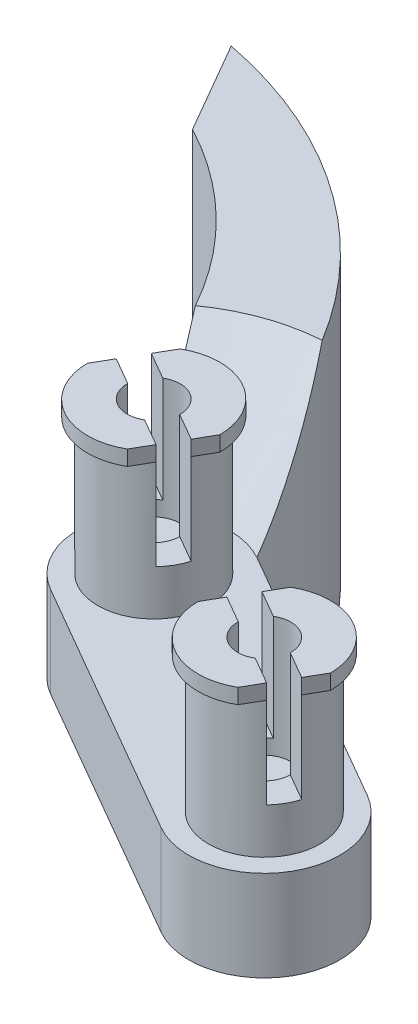
from build123d import *

# Parameters (mm, degrees)
BOSS_EXTRUDE4_DEPTH       = 6
SKETCH1_10_R              = 3.7
SKETCH1_10_R_2            = 1.75
BOSS_EXTRUDE6_DEPTH       = 15
CUT_EXTRUDE1_START        = -6
CUT_EXTRUDE1_DEPTH        = 6
SKETCH6_R                 = 1.75
BOSS_EXTRUDE7_DEPTH       = 2
BOSS_EXTRUDE8_DEPTH       = 1
BOSS_EXTRUDE10_DEPTH      = 13
BOSS_EXTRUDE10_DEPTH_BACK = 6
CHAMFER2_SIZE             = 7
CUT_EXTRUDE2_DEPTH        = 1


with BuildPart() as part:
    # Sketch1 → Boss-Extrude4 (new body)
    with BuildSketch(Plane(origin=(0, 0, 0), x_dir=(1, 0, 0), z_dir=(0, 1, 0))):
        with BuildLine():
            Line((2.5, 4.330127019), (-14.820508076, 14.330127019))
            ThreePointArc((-14.820508076, 14.330127019), (-18.6051305, 14.794276156), (-21.650635095, 12.5))
            ThreePointArc((-21.650635095, 12.5), (-22.150137207, 8.705904774), (-19.820508076, 5.669872981))
            Line((-19.820508076, 5.669872981), (-2.5, -4.330127019))
            ThreePointArc((-2.5, -4.330127019), (4.330127019, -2.5), (2.5, 4.330127019))
        make_face()
    extrude(amount=BOSS_EXTRUDE4_DEPTH)

    # Sketch1<10> → Boss-Extrude6 (add)
    # profile 1 of 2: a face of its own
    with BuildSketch(Plane(origin=(0, 0, 0), x_dir=(1, 0, 0), z_dir=(0, 1, 0))):
        with Locations(Location((0, 0, 0), (0, 0, 270))):
            Circle(SKETCH1_10_R)
        with Locations(Location((0, 0, 0), (0, 0, 270))):
            Circle(SKETCH1_10_R_2, mode=Mode.SUBTRACT)
    # profile 2 of 2: a face of its own
    with BuildSketch(Plane(origin=(0, 0, 0), x_dir=(1, 0, 0), z_dir=(0, 1, 0))):
        with Locations(Location((-17.320508076, 10, 0), (0, 0, 270))):
            Circle(SKETCH1_10_R)
        with Locations(Location((-17.320508076, 10, 0), (0, 0, 270))):
            Circle(SKETCH1_10_R_2, mode=Mode.SUBTRACT)
    extrude(amount=BOSS_EXTRUDE6_DEPTH)

    # Sketch5 → Cut-Extrude1 (cut)
    with BuildSketch(Plane(origin=(0, 15, 0), x_dir=(1, 0, 0), z_dir=(0, 1, 0)).offset(CUT_EXTRUDE1_START)):
        with BuildLine():
            Line((-20.014101509, 12.536642351), (-18.220272206, 11.50097452))
            ThreePointArc((-18.220272206, 11.50097452), (-18.836052532, 10.875), (-19.070272206, 10.028731334))
            Line((-19.070272206, 10.028731334), (-20.864101509, 11.064399165))
            ThreePointArc((-20.864101509, 11.064399165), (-20.52480207, 11.85), (-20.014101509, 12.536642351))
        make_face()
        with BuildLine():
            Line((-13.776914643, 8.935600835), (-15.570743946, 9.971268666))
            ThreePointArc((-15.570743946, 9.971268666), (-15.804963619, 9.125), (-16.420743946, 8.49902548))
            Line((-16.420743946, 8.49902548), (-14.626914643, 7.463357649))
            ThreePointArc((-14.626914643, 7.463357649), (-14.116214082, 8.15), (-13.776914643, 8.935600835))
        make_face()
        with BuildLine():
            Line((2.693593433, -2.536642351), (0.89976413, -1.50097452))
            ThreePointArc((0.89976413, -1.50097452), (1.515544457, -0.875), (1.74976413, -0.028731334))
            Line((1.74976413, -0.028731334), (3.543593433, -1.064399165))
            ThreePointArc((3.543593433, -1.064399165), (3.204293994, -1.85), (2.693593433, -2.536642351))
        make_face()
        with BuildLine():
            Line((-3.543593433, 1.064399165), (-1.74976413, 0.028731334))
            ThreePointArc((-1.74976413, 0.028731334), (-1.515544457, 0.875), (-0.89976413, 1.50097452))
            Line((-0.89976413, 1.50097452), (-2.693593433, 2.536642351))
            ThreePointArc((-2.693593433, 2.536642351), (-3.204293994, 1.85), (-3.543593433, 1.064399165))
        make_face()
    extrude(amount=CUT_EXTRUDE1_DEPTH, mode=Mode.SUBTRACT)

    # Sketch6 → Boss-Extrude7 (add)
    with BuildSketch(Plane(origin=(0, 6, 0), x_dir=(1, 0, 0), z_dir=(0, 1, 0))):
        with Locations(Location((-17.320508076, 10, 0), (0, 0, 120.940718932))):
            Circle(SKETCH6_R)
        with Locations(Location((0, 0, 0), (0, 0, 90))):
            Circle(SKETCH6_R)
    extrude(amount=BOSS_EXTRUDE7_DEPTH)

    # Sketch8 → Boss-Extrude8 (add)
    with BuildSketch(Plane(origin=(0, 15, 0), x_dir=(1, 0, 0), z_dir=(0, 1, 0))):
        with BuildLine():
            Line((-18.220272206, 11.50097452), (-20.447114211, 12.786642351))
            ThreePointArc((-20.447114211, 12.786642351), (-15.161166743, 13.7400889), (-13.343901941, 8.685600835))
            Line((-13.343901941, 8.685600835), (-15.570743946, 9.971268666))
            ThreePointArc((-15.570743946, 9.971268666), (-16.445508076, 11.515544457), (-18.220272206, 11.50097452))
        make_face()
        with BuildLine():
            Line((-16.420743946, 8.49902548), (-14.193901941, 7.213357649))
            ThreePointArc((-14.193901941, 7.213357649), (-19.479849409, 6.2599111), (-21.297114211, 11.314399165))
            Line((-21.297114211, 11.314399165), (-19.070272206, 10.028731334))
            ThreePointArc((-19.070272206, 10.028731334), (-18.195508076, 8.484455543), (-16.420743946, 8.49902548))
        make_face()
        with BuildLine():
            Line((0.89976413, -1.50097452), (3.126606135, -2.786642351))
            ThreePointArc((3.126606135, -2.786642351), (-2.159341333, -3.7400889), (-3.976606135, 1.314399165))
            Line((-3.976606135, 1.314399165), (-1.74976413, 0.028731334))
            ThreePointArc((-1.74976413, 0.028731334), (-0.875, -1.515544457), (0.89976413, -1.50097452))
        make_face()
        with BuildLine():
            Line((-0.89976413, 1.50097452), (-3.126606135, 2.786642351))
            ThreePointArc((-3.126606135, 2.786642351), (2.159341333, 3.7400889), (3.976606135, -1.314399165))
            Line((3.976606135, -1.314399165), (1.74976413, -0.028731334))
            ThreePointArc((1.74976413, -0.028731334), (0.875, 1.515544457), (-0.89976413, 1.50097452))
        make_face()
    extrude(amount=BOSS_EXTRUDE8_DEPTH)

    # Sketch1<12> → Boss-Extrude10 (add, two sides: drawn at the far end of the back side and taken through both)
    with BuildSketch(Plane(origin=(0, 0, 0), x_dir=(1, 0, 0), z_dir=(0, 1, 0)).offset(-BOSS_EXTRUDE10_DEPTH_BACK)):
        with BuildLine():
            Line((-34.490381057, 29.739092363), (-37.990381057, 35.801270189))
            ThreePointArc((-37.990381057, 35.801270189), (-23.350583329, 28.362250924), (-14.820508076, 14.330127019))
            ThreePointArc((-14.820508076, 14.330127019), (-18.6051305, 14.794276156), (-21.650635095, 12.5))
            ThreePointArc((-21.650635095, 12.5), (-26.123146339, 22.569949107), (-34.490381057, 29.739092363))
        make_face()
    extrude(amount=BOSS_EXTRUDE10_DEPTH + BOSS_EXTRUDE10_DEPTH_BACK)

    # Chamfer2
    # the kernel refuses this chamfer: 7 mm, written as the material it takes off along each edge
    with BuildSketch(Plane(origin=(-17.287458299, -6, -9.876656552), x_dir=(0.2618523083710211, 0, 0.9651079569668709), z_dir=(-0.9651079569668709, 0, 0.2618523083710211))) as chamfer2_piece_1_section:
        Polygon((5.09109444 + CHAMFER2_SIZE, 0), (5.09109444, CHAMFER2_SIZE), (5.09109444, 0), align=None)
    chamfer2_piece_1 = revolve(axis=Axis((-17.287458299, -6, -9.876656552), (0, 1, 0)), revolution_arc=359.64, mode=Mode.PRIVATE)
    chamfer2_piece_1 = split(chamfer2_piece_1, bisect_by=Plane(origin=(-19.646446417, 0, -18.680520064), z_dir=(0, -1, 0)), keep=Keep.TOP, mode=Mode.PRIVATE)
    add(chamfer2_piece_1, mode=Mode.SUBTRACT)
    with BuildSketch(Plane(origin=(-17.287458299, 13, -9.876656552), x_dir=(0.2618523083710211, 0, 0.9651079569668709), z_dir=(-0.9651079569668709, 0, 0.2618523083710211))) as chamfer2_piece_2_section:
        Polygon((5.09109444 + CHAMFER2_SIZE, 0), (5.09109444, -CHAMFER2_SIZE), (5.09109444, 0), align=None)
    chamfer2_piece_2 = revolve(axis=Axis((-17.287458299, 13, -9.876656552), (0, 1, 0)), revolution_arc=359.64, mode=Mode.PRIVATE)
    chamfer2_piece_2 = split(chamfer2_piece_2, bisect_by=Plane(origin=(-19.516900024, 6, -18.197046345), z_dir=(0, 1, 0)), keep=Keep.TOP, mode=Mode.PRIVATE)
    add(chamfer2_piece_2, mode=Mode.SUBTRACT)

    # Sketch9 → Cut-Extrude2 (cut)
    with BuildSketch(Plane(origin=(0, 16, 0), x_dir=(1, 0, 0), z_dir=(0, 1, 0))):
        Polygon((-20.864101509, 11.064399165), (-21.559190629, 9.860469492), (-22.101511133, 10.173578381), (-21.406422012, 11.377508053), align=None)
        Polygon((-20.014101509, 12.536642351), (-19.319012388, 13.740572024), (-19.910294762, 14.081949062), (-20.605383883, 12.878019389), align=None)
        Polygon((-12.490543148, 9.79815347), (-13.081825522, 10.139530508), (-13.776914643, 8.935600835), (-13.185632268, 8.594223797), align=None)
        Polygon((-14.084594139, 7.15024876), (-14.626914643, 7.463357649), (-15.322003763, 6.259427976), (-14.77968326, 5.946319087), align=None)
        Polygon((-3.543593433, 1.064399165), (-4.238682554, -0.139530508), (-4.781003057, 0.173578381), (-4.085913936, 1.377508053), align=None)
        Polygon((-2.693593433, 2.536642351), (-1.998504312, 3.740572024), (-2.589786687, 4.081949062), (-3.284875807, 2.878019389), align=None)
        Polygon((4.829964928, -0.20184653), (4.238682554, 0.139530508), (3.543593433, -1.064399165), (4.134875807, -1.405776203), align=None)
        Polygon((3.235913936, -2.84975124), (2.693593433, -2.536642351), (1.998504312, -3.740572024), (2.540824816, -4.053680913), align=None)
    extrude(amount=-CUT_EXTRUDE2_DEPTH, mode=Mode.SUBTRACT)


solid = part.part
